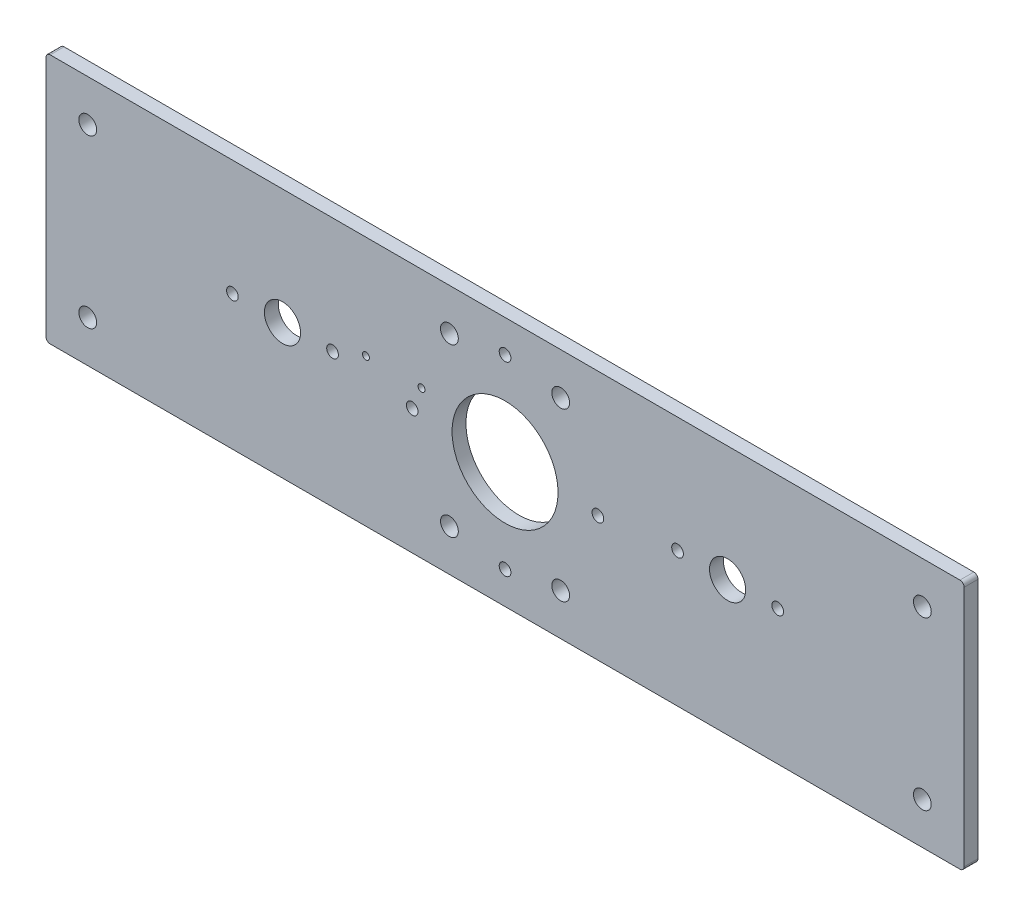
from build123d import *

# Parameters (mm, degrees)
SKETCH1_W             = 330
SKETCH1_H             = 90
SKETCH1_R             = 19.05
BOSS_EXTRUDE1_DEPTH   = 2.5
M6_CLEARANCE_HOLE1_D  = 6.4
SKETCH3_R             = 6.5
CUT_EXTRUDE2_DEPTH    = 172.099386323
M5X0_8_TAPPED_HOLE1_D = 4.2
M5X0_8_TAPPED_HOLE3_D = 4.2
FILLET1_R             = 1.5
M3X0_5_TAPPED_HOLE1_D = 2.5


with BuildPart() as part:
    # Sketch1 → Boss-Extrude1 (new, symmetric)
    with BuildSketch(Plane.XY):
        Rectangle(SKETCH1_W, SKETCH1_H)
        Circle(SKETCH1_R, mode=Mode.SUBTRACT)
    extrude(amount=BOSS_EXTRUDE1_DEPTH, both=True)

    # M6 Clearance Hole1 (through all)
    with Locations(Plane.XY.offset(2.5)):
        with Locations((-150, 30), (-20, 30), (-20, -30), (-150, -30)):
            m6_clearance_hole1 = Hole(M6_CLEARANCE_HOLE1_D / 2)

    # Mirror2: M6 Clearance Hole1 across plane
    add(m6_clearance_hole1.mirror(Plane(origin=(0, 0, 0), x_dir=(0, 0, 1), z_dir=(1, 0, 0))), mode=Mode.SUBTRACT)

    # Sketch3 → Cut-Extrude2 (cut, through all)
    with BuildSketch(Plane.XY.offset(2.5)):
        with Locations((-80, 3.4)):
            Circle(SKETCH3_R)
    cut_extrude2 = extrude(amount=-CUT_EXTRUDE2_DEPTH, mode=Mode.SUBTRACT)

    # M5x0.8 Tapped Hole1 (through all)
    with Locations(Plane.XY.offset(2.5)):
        with Locations((-98, 3.4), (-62, 3.4)):
            m5x0_8_tapped_hole1 = Hole(M5X0_8_TAPPED_HOLE1_D / 2)

    # Mirror1: Cut-Extrude2, M5x0.8 Tapped Hole1 across plane
    add(cut_extrude2.mirror(Plane(origin=(0, 0, 0), x_dir=(0, 0, 1), z_dir=(1, 0, 0))), mode=Mode.SUBTRACT)
    add(m5x0_8_tapped_hole1.mirror(Plane(origin=(0, 0, 0), x_dir=(0, 0, 1), z_dir=(1, 0, 0))), mode=Mode.SUBTRACT)

    # M5x0.8 Tapped Hole3 (through all)
    with Locations(Plane.XY.offset(2.5)):
        with Locations((0, 33.375440072), (0, -33.375440072), (-33.375440072, 0), (33.375440072, 0)):
            Hole(M5X0_8_TAPPED_HOLE3_D / 2)

    # Fillet1
    fillet1_edges = [part.edges().sort_by_distance(p)[0] for p in [
        (-165, -45, 0),
        (165, -45, 0),
        (165, 45, 0),
        (-165, 45, 0),
    ]]
    fillet(fillet1_edges, radius=FILLET1_R)

    # M3x0.5 Tapped Hole1 (through all)
    with Locations(Plane.XY.offset(2.5)):
        with Locations((-50, 8), (-30, 8)):
            Hole(M3X0_5_TAPPED_HOLE1_D / 2)


solid = part.part
